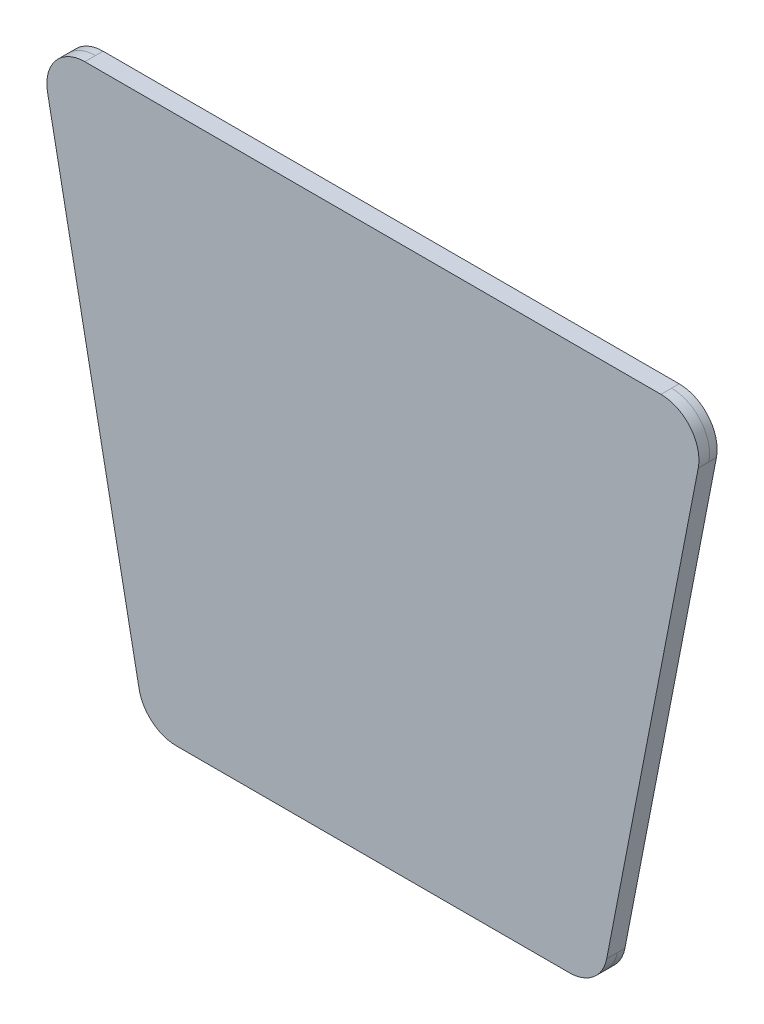
from build123d import *

# Parameters (mm, degrees)
BOSS_EXTRUDE2_DEPTH  = 12
FILLET1_R            = 25
CUT_EXTRUDE1_DEPTH   = 10
BOSS_EXTRUDE5_START  = 10
SKETCH4_R            = 23
SKETCH4_R_2          = 19
BOSS_EXTRUDE5_DEPTH  = 10
BOSS_EXTRUDE6_START  = 10
SKETCH5_R            = 23
SKETCH5_R_2          = 19
BOSS_EXTRUDE6_DEPTH  = 10
BOSS_EXTRUDE9_DEPTH  = 4
BOSS_EXTRUDE11_DEPTH = 4
BOSS_EXTRUDE12_DEPTH = 4
BOSS_EXTRUDE13_DEPTH = 4
BOSS_EXTRUDE15_DEPTH = 4
BOSS_EXTRUDE16_DEPTH = 4
BOSS_EXTRUDE17_DEPTH = 4
BOSS_EXTRUDE18_DEPTH = 5
FILLET3_R            = 25


with BuildPart() as part:
    # Sketch1 → Boss-Extrude2 (new body)
    with BuildSketch(Plane.XY):
        Polygon((-220, 0), (220, 0), (150, -360), (-150, -360), align=None)
    extrude(amount=BOSS_EXTRUDE2_DEPTH)

    # Fillet1
    fillet1_edges = [part.edges().sort_by_distance(p)[0] for p in [
        (150, -360, 6),
        (220, 0, 6),
        (-220, 0, 6),
        (-150, -360, 6),
    ]]
    fillet(fillet1_edges, radius=FILLET1_R)

    # Sketch3 → Cut-Extrude1 (cut)
    with BuildSketch(Plane(origin=(0, 0, 0), x_dir=(-1, 0, 0), z_dir=(0, 0, -1))):
        with BuildLine():
            Line((189.670665527, -2), (-189.670665527, -2))
            ThreePointArc((-189.670665527, -2), (-207.418482993, -10.37074933), (-212.247819489, -29.390002159))
            Line((-212.247819489, -29.390002159), (-151.970041711, -339.390002159))
            ThreePointArc((-151.970041711, -339.390002159), (-144.022138419, -352.747817467), (-129.392887749, -358))
            Line((-129.392887749, -358), (129.392887749, -358))
            ThreePointArc((129.392887749, -358), (144.022138419, -352.747817467), (151.970041711, -339.390002159))
            Line((151.970041711, -339.390002159), (212.247819489, -29.390002159))
            ThreePointArc((212.247819489, -29.390002159), (207.418482993, -10.37074933), (189.670665527, -2))
        make_face()
    extrude(amount=-CUT_EXTRUDE1_DEPTH, mode=Mode.SUBTRACT)

    # Sketch4 → Boss-Extrude5 (add)
    with BuildSketch(Plane(origin=(0, 0, 10), x_dir=(-1, 0, 0), z_dir=(0, 0, -1)).offset(BOSS_EXTRUDE5_START)):
        with Locations((-189.670665527, -25)):
            Circle(SKETCH4_R)
        with Locations((-189.670665527, -25)):
            Circle(SKETCH4_R_2, mode=Mode.SUBTRACT)
    boss_extrude5 = extrude(amount=-BOSS_EXTRUDE5_DEPTH)

    # Sketch5 → Boss-Extrude6 (add)
    with BuildSketch(Plane(origin=(0, 0, 10), x_dir=(-1, 0, 0), z_dir=(0, 0, -1)).offset(BOSS_EXTRUDE6_START)):
        with Locations((-129.392887749, -335)):
            Circle(SKETCH5_R)
        with Locations((-129.392887749, -335)):
            Circle(SKETCH5_R_2, mode=Mode.SUBTRACT)
    boss_extrude6 = extrude(amount=-BOSS_EXTRUDE6_DEPTH)

    # Mirror1: Boss-Extrude5, Boss-Extrude6 across plane
    add(boss_extrude5.mirror(Plane(origin=(0, 0, 0), x_dir=(0, 0, 1), z_dir=(1, 0, 0))))
    add(boss_extrude6.mirror(Plane(origin=(0, 0, 0), x_dir=(0, 0, 1), z_dir=(1, 0, 0))))

    # Sketch9 → Boss-Extrude9 (add)
    with BuildSketch(Plane.XY.offset(6)):
        Polygon((-0.414213562, -179), (-1, -179.585786438), (-1, -180.414213562), (-0.414213562, -181), (0.414213562, -181), (1, -180.414213562), (1, -179.585786438), (0.414213562, -179), align=None)
        Polygon((0.414213562, -179), (0, -178.585786438), (-0.414213562, -179), align=None)
        Polygon((1, -179), (0.414213562, -179), (1, -179.585786438), align=None)
        Polygon((1.414213562, -180), (1, -179.585786438), (1, -180.414213562), align=None)
        Polygon((0.414213562, -181), (-0.414213562, -181), (0, -181.414213562), align=None)
        Polygon((-0.414213562, -181), (-1, -180.414213562), (-1, -181), align=None)
        Polygon((-1, -180.414213562), (-1, -179.585786438), (-1.414213562, -180), align=None)
        Polygon((-0.414213562, -181), (-1, -181), (-1, -182.414213562), (0, -181.414213562), align=None)
        Polygon((-1, -181), (-1, -180.414213562), (-1.414213562, -180), (-2.414213562, -181), align=None)
        Polygon((-1, -179.585786438), (-1, -179), (-2.414213562, -179), (-1.414213562, -180), align=None)
        Polygon((-0.414213562, -179), (-1, -179), (-1, -179.585786438), align=None)
        Polygon((0, -178.585786438), (-1, -177.585786438), (-1, -179), (-0.414213562, -179), align=None)
        Polygon((1, -177.585786438), (0, -178.585786438), (0.414213562, -179), (1, -179), align=None)
        Polygon((2.414213562, -179), (1, -179), (1, -179.585786438), (1.414213562, -180), align=None)
        Polygon((1.414213562, -180), (1, -180.414213562), (1, -181), (2.414213562, -181), align=None)
        Polygon((1, -181), (1, -180.414213562), (0.414213562, -181), align=None)
        Polygon((0.414213562, -181), (0, -181.414213562), (1, -182.414213562), (1, -181), align=None)
        with BuildLine():
            Line((2.414213562, -181), (1, -181))
            Line((1, -181), (1, -182.414213562))
            Line((1, -182.414213562), (130.618462554, -312.032676116))
            ThreePointArc((130.618462554, -312.032676116), (132.241512472, -312.177087452), (133.850264632, -312.43605107))
            Line((133.850264632, -312.43605107), (2.414213562, -181))
        make_face()
        Polygon((0, -181.414213562), (-1, -182.414213562), (-1, -358), (1, -358), (1, -182.414213562), align=None)
        with BuildLine():
            Line((-1, -182.414213562), (-1, -181))
            Line((-1, -181), (-2.414213562, -181))
            Line((-2.414213562, -181), (-133.850264632, -312.43605107))
            ThreePointArc((-133.850264632, -312.43605107), (-132.241512472, -312.177087452), (-130.618462554, -312.032676116))
            Line((-130.618462554, -312.032676116), (-1, -182.414213562))
        make_face()
        Polygon((-1.414213562, -180), (-2.414213562, -179), (-183.156986575, -179), (-182.768097687, -181), (-2.414213562, -181), align=None)
        Polygon((-1, -179), (-1, -177.585786438), (-176.585786438, -2), (-179.414213562, -2), (-2.414213562, -179), align=None)
        Polygon((1, -2), (-1, -2), (-1, -177.585786438), (0, -178.585786438), (1, -177.585786438), align=None)
        Polygon((176.585786438, -2), (1, -177.585786438), (1, -179), (2.414213562, -179), (179.414213562, -2), align=None)
        Polygon((183.156986575, -179), (2.414213562, -179), (1.414213562, -180), (2.414213562, -181), (182.768097687, -181), align=None)
    extrude(amount=BOSS_EXTRUDE9_DEPTH)

    # Sketch10 → Boss-Extrude11 (add)
    with BuildSketch(Plane.XY.offset(6)):
        with BuildLine():
            ThreePointArc((18.741451982, -159.844334456), (9.567085809, -156.903011687), (1, -152.495584429))
            Line((1, -152.495584429), (1, -154.679505306))
            ThreePointArc((1, -154.679505306), (8.801718944, -158.750770752), (17.19718672, -161.388599717))
            Line((17.19718672, -161.388599717), (18.741451982, -159.844334456))
        make_face()
        with BuildLine():
            ThreePointArc((27.504415571, -179), (23.096988313, -170.432914191), (20.155665544, -161.258548018))
            Line((20.155665544, -161.258548018), (18.611400283, -162.80281328))
            ThreePointArc((18.611400283, -162.80281328), (21.249229248, -171.198281056), (25.320494694, -179))
            Line((25.320494694, -179), (27.504415571, -179))
        make_face()
        with BuildLine():
            ThreePointArc((-1, -152.495584429), (-9.567085809, -156.903011687), (-18.741451982, -159.844334456))
            Line((-18.741451982, -159.844334456), (-17.19718672, -161.388599717))
            ThreePointArc((-17.19718672, -161.388599717), (-8.801718944, -158.750770752), (-1, -154.679505306))
            Line((-1, -154.679505306), (-1, -152.495584429))
        make_face()
        with BuildLine():
            ThreePointArc((-20.155665544, -161.258548018), (-23.096988313, -170.432914191), (-27.504415571, -179))
            Line((-27.504415571, -179), (-25.320494694, -179))
            ThreePointArc((-25.320494694, -179), (-21.249229248, -171.198281056), (-18.611400283, -162.80281328))
            Line((-18.611400283, -162.80281328), (-20.155665544, -161.258548018))
        make_face()
        with BuildLine():
            Line((-25.320494694, -181), (-27.504415571, -181))
            ThreePointArc((-27.504415571, -181), (-23.096988313, -189.567085809), (-20.155665544, -198.741451982))
            Line((-20.155665544, -198.741451982), (-18.611400283, -197.19718672))
            ThreePointArc((-18.611400283, -197.19718672), (-21.249229248, -188.801718944), (-25.320494694, -181))
        make_face()
        with BuildLine():
            Line((-17.19718672, -198.611400283), (-18.741451982, -200.155665544))
            ThreePointArc((-18.741451982, -200.155665544), (-9.567085809, -203.096988313), (-1, -207.504415571))
            Line((-1, -207.504415571), (-1, -205.320494694))
            ThreePointArc((-1, -205.320494694), (-8.801718944, -201.249229248), (-17.19718672, -198.611400283))
        make_face()
        with BuildLine():
            Line((1, -205.320494694), (1, -207.504415571))
            ThreePointArc((1, -207.504415571), (9.567085809, -203.096988313), (18.741451982, -200.155665544))
            Line((18.741451982, -200.155665544), (17.19718672, -198.611400283))
            ThreePointArc((17.19718672, -198.611400283), (8.801718944, -201.249229248), (1, -205.320494694))
        make_face()
        with BuildLine():
            Line((27.504415571, -181), (25.320494694, -181))
            ThreePointArc((25.320494694, -181), (21.249229248, -188.801718944), (18.611400283, -197.19718672))
            Line((18.611400283, -197.19718672), (20.155665544, -198.741451982))
            ThreePointArc((20.155665544, -198.741451982), (23.096988313, -189.567085809), (27.504415571, -181))
        make_face()
    extrude(amount=BOSS_EXTRUDE11_DEPTH)

    # Sketch10<6> → Boss-Extrude12 (add)
    with BuildSketch(Plane.XY.offset(6)):
        with BuildLine():
            ThreePointArc((30.280763407, -148.30502303), (15.307337295, -143.0448187), (1, -136.176533711))
            Line((1, -136.176533711), (1, -138.348649944))
            ThreePointArc((1, -138.348649944), (14.54197043, -144.892577765), (28.744845289, -149.840941149))
            Line((28.744845289, -149.840941149), (30.280763407, -148.30502303))
        make_face()
        with BuildLine():
            ThreePointArc((43.823466289, -179), (36.9551813, -164.692662705), (31.69497697, -149.719236593))
            Line((31.69497697, -149.719236593), (30.159058851, -151.255154711))
            ThreePointArc((30.159058851, -151.255154711), (35.107422235, -165.45802957), (41.651350056, -179))
            Line((41.651350056, -179), (43.823466289, -179))
        make_face()
        with BuildLine():
            ThreePointArc((-1, -136.176533711), (-15.307337295, -143.0448187), (-30.280763407, -148.30502303))
            Line((-30.280763407, -148.30502303), (-28.744845289, -149.840941149))
            ThreePointArc((-28.744845289, -149.840941149), (-14.54197043, -144.892577765), (-1, -138.348649944))
            Line((-1, -138.348649944), (-1, -136.176533711))
        make_face()
        with BuildLine():
            ThreePointArc((-31.69497697, -149.719236593), (-36.9551813, -164.692662705), (-43.823466289, -179))
            Line((-43.823466289, -179), (-41.651350056, -179))
            ThreePointArc((-41.651350056, -179), (-35.107422235, -165.45802957), (-30.159058851, -151.255154711))
            Line((-30.159058851, -151.255154711), (-31.69497697, -149.719236593))
        make_face()
        with BuildLine():
            Line((-41.651350056, -181), (-43.823466289, -181))
            ThreePointArc((-43.823466289, -181), (-36.9551813, -195.307337295), (-31.69497697, -210.280763407))
            Line((-31.69497697, -210.280763407), (-30.159058851, -208.744845289))
            ThreePointArc((-30.159058851, -208.744845289), (-35.107422235, -194.54197043), (-41.651350056, -181))
        make_face()
        with BuildLine():
            Line((-28.744845289, -210.159058851), (-30.280763407, -211.69497697))
            ThreePointArc((-30.280763407, -211.69497697), (-15.307337295, -216.9551813), (-1, -223.823466289))
            Line((-1, -223.823466289), (-1, -221.651350056))
            ThreePointArc((-1, -221.651350056), (-14.54197043, -215.107422235), (-28.744845289, -210.159058851))
        make_face()
        with BuildLine():
            Line((1, -221.651350056), (1, -223.823466289))
            ThreePointArc((1, -223.823466289), (15.307337295, -216.9551813), (30.280763407, -211.69497697))
            Line((30.280763407, -211.69497697), (28.744845289, -210.159058851))
            ThreePointArc((28.744845289, -210.159058851), (14.54197043, -215.107422235), (1, -221.651350056))
        make_face()
        with BuildLine():
            ThreePointArc((31.69497697, -210.280763407), (36.9551813, -195.307337295), (43.823466289, -181))
            Line((43.823466289, -181), (41.651350056, -181))
            ThreePointArc((41.651350056, -181), (35.107422235, -194.54197043), (30.159058851, -208.744845289))
            Line((30.159058851, -208.744845289), (31.69497697, -210.280763407))
        make_face()
    extrude(amount=BOSS_EXTRUDE12_DEPTH)

    # Sketch10<7> → Boss-Extrude13 (add)
    with BuildSketch(Plane.XY.offset(6)):
        with BuildLine():
            ThreePointArc((45.621034089, -132.964752348), (22.961005942, -124.567228049), (1, -114.482114862))
            Line((1, -114.482114862), (1, -116.650118761))
            ThreePointArc((1, -116.650118761), (22.195639077, -126.414987114), (44.08802383, -134.497762608))
            Line((44.08802383, -134.497762608), (45.621034089, -132.964752348))
        make_face()
        with BuildLine():
            ThreePointArc((65.517885138, -179), (55.432771951, -157.038994058), (47.035247652, -134.378965911))
            Line((47.035247652, -134.378965911), (45.502237392, -135.91197617))
            ThreePointArc((45.502237392, -135.91197617), (53.585012886, -157.804360923), (63.349881239, -179))
            Line((63.349881239, -179), (65.517885138, -179))
        make_face()
        with BuildLine():
            ThreePointArc((47.035247652, -225.621034089), (55.432771951, -202.961005942), (65.517885138, -181))
            Line((65.517885138, -181), (63.349881239, -181))
            ThreePointArc((63.349881239, -181), (53.585012886, -202.195639077), (45.502237392, -224.08802383))
            Line((45.502237392, -224.08802383), (47.035247652, -225.621034089))
        make_face()
        with BuildLine():
            Line((1, -243.349881239), (1, -245.517885138))
            ThreePointArc((1, -245.517885138), (22.961005942, -235.432771951), (45.621034089, -227.035247652))
            Line((45.621034089, -227.035247652), (44.08802383, -225.502237392))
            ThreePointArc((44.08802383, -225.502237392), (22.195639077, -233.585012886), (1, -243.349881239))
        make_face()
        with BuildLine():
            Line((-44.08802383, -225.502237392), (-45.621034089, -227.035247652))
            ThreePointArc((-45.621034089, -227.035247652), (-22.961005942, -235.432771951), (-1, -245.517885138))
            Line((-1, -245.517885138), (-1, -243.349881239))
            ThreePointArc((-1, -243.349881239), (-22.195639077, -233.585012886), (-44.08802383, -225.502237392))
        make_face()
        with BuildLine():
            Line((-63.349881239, -181), (-65.517885138, -181))
            ThreePointArc((-65.517885138, -181), (-55.432771951, -202.961005942), (-47.035247652, -225.621034089))
            Line((-47.035247652, -225.621034089), (-45.502237392, -224.08802383))
            ThreePointArc((-45.502237392, -224.08802383), (-53.585012886, -202.195639077), (-63.349881239, -181))
        make_face()
        with BuildLine():
            ThreePointArc((-47.035247652, -134.378965911), (-55.432771951, -157.038994058), (-65.517885138, -179))
            Line((-65.517885138, -179), (-63.349881239, -179))
            ThreePointArc((-63.349881239, -179), (-53.585012886, -157.804360923), (-45.502237392, -135.91197617))
            Line((-45.502237392, -135.91197617), (-47.035247652, -134.378965911))
        make_face()
        with BuildLine():
            ThreePointArc((-1, -114.482114862), (-22.961005942, -124.567228049), (-45.621034089, -132.964752348))
            Line((-45.621034089, -132.964752348), (-44.08802383, -134.497762608))
            ThreePointArc((-44.08802383, -134.497762608), (-22.195639077, -126.414987114), (-1, -116.650118761))
            Line((-1, -116.650118761), (-1, -114.482114862))
        make_face()
    extrude(amount=BOSS_EXTRUDE13_DEPTH)

    # Sketch10<9> → Boss-Extrude15 (add)
    with BuildSketch(Plane.XY.offset(6)):
        with BuildLine():
            Line((1, -275.854623856), (1, -278.02082749))
            ThreePointArc((1, -278.02082749), (34.441508913, -263.149157926), (68.604085034, -250.018298597))
            Line((68.604085034, -250.018298597), (67.072347756, -248.486561318))
            ThreePointArc((67.072347756, -248.486561318), (33.676142048, -261.301398861), (1, -275.854623856))
        make_face()
        with BuildLine():
            ThreePointArc((70.018298597, -248.604085034), (83.149157926, -214.441508913), (98.02082749, -181))
            Line((98.02082749, -181), (95.854623856, -181))
            ThreePointArc((95.854623856, -181), (81.301398861, -213.676142048), (68.486561318, -247.072347756))
            Line((68.486561318, -247.072347756), (70.018298597, -248.604085034))
        make_face()
        with BuildLine():
            ThreePointArc((98.02082749, -179), (83.149157926, -145.558491087), (70.018298597, -111.395914966))
            Line((70.018298597, -111.395914966), (68.486561318, -112.927652244))
            ThreePointArc((68.486561318, -112.927652244), (81.301398861, -146.323857952), (95.854623856, -179))
            Line((95.854623856, -179), (98.02082749, -179))
        make_face()
        with BuildLine():
            ThreePointArc((68.604085034, -109.981701403), (34.441508913, -96.850842074), (1, -81.97917251))
            Line((1, -81.97917251), (1, -84.145376144))
            ThreePointArc((1, -84.145376144), (33.676142048, -98.698601139), (67.072347756, -111.513438682))
            Line((67.072347756, -111.513438682), (68.604085034, -109.981701403))
        make_face()
        with BuildLine():
            ThreePointArc((-1, -81.97917251), (-34.441508913, -96.850842074), (-68.604085034, -109.981701403))
            Line((-68.604085034, -109.981701403), (-67.072347756, -111.513438682))
            ThreePointArc((-67.072347756, -111.513438682), (-33.676142048, -98.698601139), (-1, -84.145376144))
            Line((-1, -84.145376144), (-1, -81.97917251))
        make_face()
        with BuildLine():
            ThreePointArc((-70.018298597, -111.395914966), (-83.149157926, -145.558491087), (-98.02082749, -179))
            Line((-98.02082749, -179), (-95.854623856, -179))
            ThreePointArc((-95.854623856, -179), (-81.301398861, -146.323857952), (-68.486561318, -112.927652244))
            Line((-68.486561318, -112.927652244), (-70.018298597, -111.395914966))
        make_face()
        with BuildLine():
            Line((-95.854623856, -181), (-98.02082749, -181))
            ThreePointArc((-98.02082749, -181), (-83.149157926, -214.441508913), (-70.018298597, -248.604085034))
            Line((-70.018298597, -248.604085034), (-68.486561318, -247.072347756))
            ThreePointArc((-68.486561318, -247.072347756), (-81.301398861, -213.676142048), (-95.854623856, -181))
        make_face()
        with BuildLine():
            Line((-67.072347756, -248.486561318), (-68.604085034, -250.018298597))
            ThreePointArc((-68.604085034, -250.018298597), (-34.441508913, -263.149157926), (-1, -278.02082749))
            Line((-1, -278.02082749), (-1, -275.854623856))
            ThreePointArc((-1, -275.854623856), (-33.676142048, -261.301398861), (-67.072347756, -248.486561318))
        make_face()
    extrude(amount=BOSS_EXTRUDE15_DEPTH)

    # Sketch10<10> → Boss-Extrude16 (add)
    with BuildSketch(Plane.XY.offset(6)):
        with BuildLine():
            ThreePointArc((100.646573758, -279.232360195), (120.104339226, -229.748846207), (141.335749615, -181))
            Line((141.335749614, -181), (139.170288384, -181))
            ThreePointArc((139.170288384, -181), (118.256580161, -228.983479343), (99.115361438, -277.701147875))
            Line((99.115361438, -277.701147875), (100.646573758, -279.232360195))
        make_face()
        with BuildLine():
            Line((1, -319.170288384), (1, -321.335749614))
            ThreePointArc((1, -321.335749615), (49.748846207, -300.104339226), (99.232360195, -280.646573758))
            Line((99.232360195, -280.646573758), (97.701147875, -279.115361438))
            ThreePointArc((97.701147875, -279.115361438), (48.983479343, -298.256580161), (1, -319.170288384))
        make_face()
        with BuildLine():
            Line((-97.701147875, -279.115361438), (-99.232360195, -280.646573758))
            ThreePointArc((-99.232360195, -280.646573758), (-49.748846207, -300.104339226), (-1, -321.335749615))
            Line((-1, -321.335749614), (-1, -319.170288384))
            ThreePointArc((-1, -319.170288384), (-48.983479343, -298.256580161), (-97.701147875, -279.115361438))
        make_face()
        with BuildLine():
            Line((-139.170288384, -181), (-141.335749614, -181))
            ThreePointArc((-141.335749615, -181), (-120.104339226, -229.748846207), (-100.646573758, -279.232360195))
            Line((-100.646573758, -279.232360195), (-99.115361438, -277.701147875))
            ThreePointArc((-99.115361438, -277.701147875), (-118.256580161, -228.983479343), (-139.170288384, -181))
        make_face()
        with BuildLine():
            ThreePointArc((-100.646573758, -80.767639805), (-120.104339226, -130.251153793), (-141.335749615, -179))
            Line((-141.335749614, -179), (-139.170288384, -179))
            ThreePointArc((-139.170288384, -179), (-118.256580161, -131.016520657), (-99.115361438, -82.298852125))
            Line((-99.115361438, -82.298852125), (-100.646573758, -80.767639805))
        make_face()
        with BuildLine():
            ThreePointArc((-1, -38.664250385), (-49.748846207, -59.895660774), (-99.232360195, -79.353426242))
            Line((-99.232360195, -79.353426242), (-97.701147875, -80.884638562))
            ThreePointArc((-97.701147875, -80.884638562), (-48.983479343, -61.743419839), (-1, -40.829711616))
            Line((-1, -40.829711616), (-1, -38.664250386))
        make_face()
        with BuildLine():
            ThreePointArc((99.232360195, -79.353426242), (49.748846207, -59.895660774), (1, -38.664250385))
            Line((1, -38.664250386), (1, -40.829711616))
            ThreePointArc((1, -40.829711616), (48.983479343, -61.743419839), (97.701147875, -80.884638562))
            Line((97.701147875, -80.884638562), (99.232360195, -79.353426242))
        make_face()
        with BuildLine():
            ThreePointArc((141.335749615, -179), (120.104339226, -130.251153793), (100.646573758, -80.767639805))
            Line((100.646573758, -80.767639805), (99.115361438, -82.298852125))
            ThreePointArc((99.115361438, -82.298852125), (118.256580161, -131.016520657), (139.170288384, -179))
            Line((139.170288384, -179), (141.335749614, -179))
        make_face()
    extrude(amount=BOSS_EXTRUDE16_DEPTH)

    # Sketch10<11> → Boss-Extrude17 (add)
    with BuildSketch(Plane.XY.offset(6)):
        with BuildLine():
            ThreePointArc((122.199111777, -56.38667466), (61.229349178, -32.179274798), (1, -6.184358815))
            Line((1, -6.184358815), (1, -8.349589094))
            ThreePointArc((1, -8.349589094), (60.463982314, -34.027033863), (120.668062764, -57.917723674))
            Line((120.668062764, -57.917723674), (122.199111777, -56.38667466))
        make_face()
        with BuildLine():
            ThreePointArc((-1, -6.184358815), (-61.229349178, -32.179274798), (-122.199111777, -56.38667466))
            Line((-122.199111777, -56.38667466), (-120.668062764, -57.917723674))
            ThreePointArc((-120.668062764, -57.917723674), (-60.463982314, -34.027033863), (-1, -8.349589094))
            Line((-1, -8.349589094), (-1, -6.184358815))
        make_face()
        with BuildLine():
            ThreePointArc((-123.61332534, -57.800888223), (-147.820725202, -118.770650822), (-173.815641185, -179))
            Line((-173.815641185, -179), (-171.650410906, -179))
            ThreePointArc((-171.650410906, -179), (-145.972966137, -119.536017686), (-122.082276326, -59.331937236))
            Line((-122.082276326, -59.331937236), (-123.61332534, -57.800888223))
        make_face()
        with BuildLine():
            Line((-171.650410906, -181), (-173.815641185, -181))
            ThreePointArc((-173.815641185, -181), (-147.820725202, -241.229349178), (-123.61332534, -302.199111777))
            Line((-123.61332534, -302.199111777), (-122.082276326, -300.668062764))
            ThreePointArc((-122.082276326, -300.668062764), (-145.972966137, -240.463982314), (-171.650410906, -181))
        make_face()
        with BuildLine():
            Line((-120.668062764, -302.082276326), (-122.199111777, -303.61332534))
            ThreePointArc((-122.199111777, -303.61332534), (-61.229349178, -327.820725202), (-1, -353.815641185))
            Line((-1, -353.815641185), (-1, -351.650410906))
            ThreePointArc((-1, -351.650410906), (-60.463982314, -325.972966137), (-120.668062764, -302.082276326))
        make_face()
        with BuildLine():
            Line((1, -351.650410906), (1, -353.815641185))
            ThreePointArc((1, -353.815641185), (61.229349178, -327.820725202), (122.199111777, -303.61332534))
            Line((122.199111777, -303.61332534), (120.668062764, -302.082276326))
            ThreePointArc((120.668062764, -302.082276326), (60.463982314, -325.972966137), (1, -351.650410906))
        make_face()
        with BuildLine():
            ThreePointArc((123.61332534, -302.199111777), (147.820725202, -241.229349178), (173.815641185, -181))
            Line((173.815641185, -181), (171.650410906, -181))
            ThreePointArc((171.650410906, -181), (145.972966137, -240.463982314), (122.082276326, -300.668062764))
            Line((122.082276326, -300.668062764), (123.61332534, -302.199111777))
        make_face()
        with BuildLine():
            ThreePointArc((173.815641185, -179), (147.820725202, -118.770650822), (123.61332534, -57.800888223))
            Line((123.61332534, -57.800888223), (122.082276326, -59.331937236))
            ThreePointArc((122.082276326, -59.331937236), (145.972966137, -119.536017686), (171.650410906, -179))
            Line((171.650410906, -179), (173.815641185, -179))
        make_face()
    extrude(amount=BOSS_EXTRUDE17_DEPTH)

    # Sketch11 → Boss-Extrude18 (add)
    with BuildSketch(Plane.XY):
        Polygon((220, 0), (-220, 0), (-150, -360), (150, -360), align=None)
    extrude(amount=BOSS_EXTRUDE18_DEPTH)

    # Fillet3
    fillet3_edges = [part.edges().sort_by_distance(p)[0] for p in [
        (-220, 0, 2.5),
        (-150, -360, 2.5),
        (150, -360, 2.5),
        (220, 0, 2.5),
    ]]
    fillet(fillet3_edges, radius=FILLET3_R - 0.0001)  # a hair under: the kernel refuses the full size


solid = part.part
